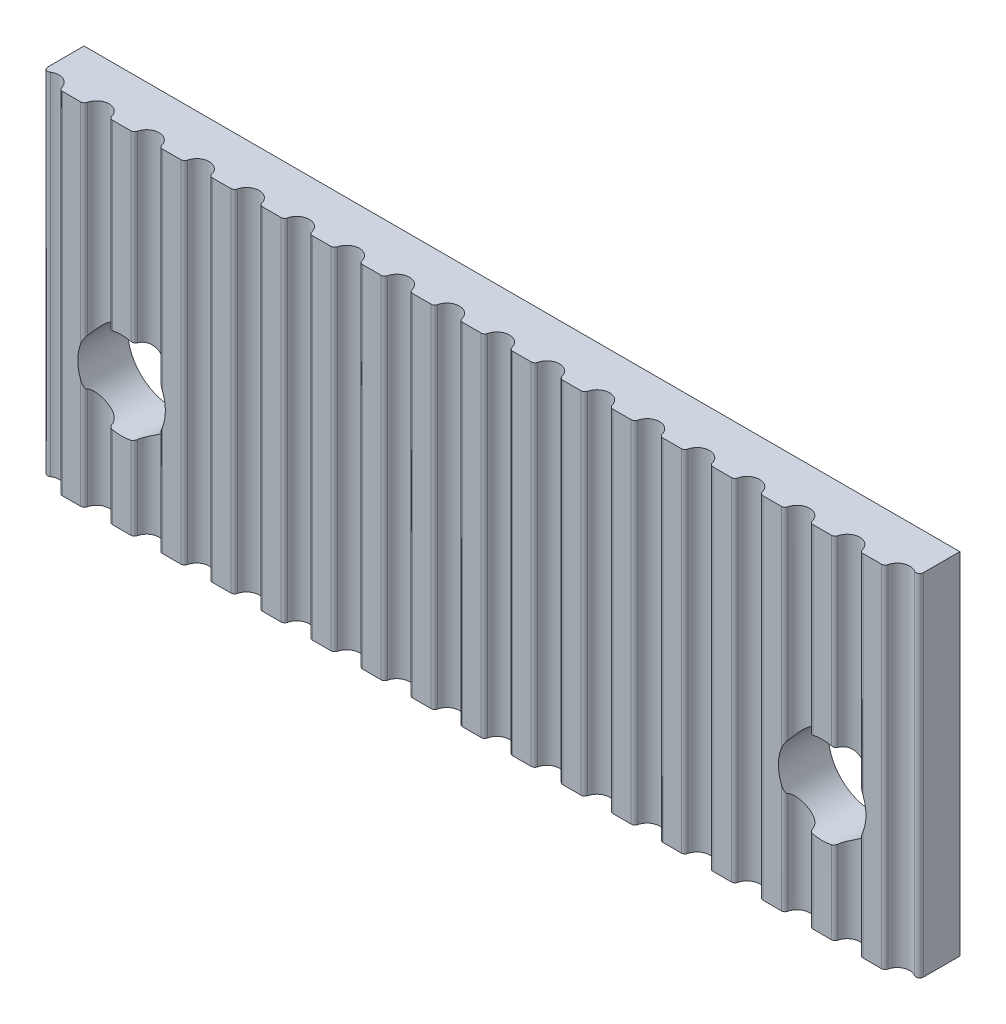
from build123d import *

# Parameters (mm, degrees)
SKETCH1_W           = 35
SKETCH1_H           = 2
BOSS_EXTRUDE1_DEPTH = 14
SKETCH2_R           = 1.75
CUT_EXTRUDE1_DEPTH  = 14
SKETCH3_R           = 0.5
CUT_EXTRUDE2_DEPTH  = 23.433234274
LPATTERN1_COUNT     = 18
LPATTERN1_PITCH     = 2
FILLET1_R           = 0.15


with BuildPart() as part:
    # Sketch1 → Boss-Extrude1 (new body)
    with BuildSketch(Plane(origin=(0, 0, 0), x_dir=(1, 0, 0), z_dir=(0, 1, 0))):
        Rectangle(SKETCH1_W, SKETCH1_H)
    extrude(amount=BOSS_EXTRUDE1_DEPTH)

    # Sketch2 → Cut-Extrude1 (cut)
    with BuildSketch(Plane.XY.offset(1)):
        with Locations((-14, 5)):
            Circle(SKETCH2_R)
        with Locations((14, 5)):
            Circle(SKETCH2_R)
    extrude(amount=-CUT_EXTRUDE1_DEPTH, mode=Mode.SUBTRACT)

    # Sketch3 → Cut-Extrude2 (cut, through all)
    with BuildSketch(Plane(origin=(0, 14, 0), x_dir=(1, 0, 0), z_dir=(0, 1, 0))):
        with Locations((-17, -1)):
            Circle(SKETCH3_R)
    cut_extrude2 = extrude(amount=-CUT_EXTRUDE2_DEPTH, mode=Mode.SUBTRACT)

    # LPattern1: Cut-Extrude2 ×18
    with Locations(*[(i * LPATTERN1_PITCH, 0, 0) for i in range(1, LPATTERN1_COUNT)]):
        add(cut_extrude2, mode=Mode.SUBTRACT)

    # Fillet1
    fillet1_edges = [part.edges().sort_by_distance(p)[0] for p in [
        (-16.5, 7, 1),
        (-17.5, 7, 1),
        (-15.5, 9.950693909, 1),
        (12.5, 2.049306091, 1),
        (13.5, 1.661474508, 1),
        (14.5, 1.661474508, 1),
        (15.5, 2.049306091, 1),
        (17.5, 7, 1),
        (16.5, 7, 1),
        (15.5, 9.950693909, 1),
        (14.5, 10.338525492, 1),
        (13.5, 10.338525492, 1),
        (12.5, 9.950693909, 1),
        (11.5, 7, 1),
        (10.5, 7, 1),
        (9.5, 7, 1),
        (8.5, 7, 1),
        (7.5, 7, 1),
        (6.5, 7, 1),
        (5.5, 7, 1),
        (4.5, 7, 1),
        (3.5, 7, 1),
        (2.5, 7, 1),
        (1.5, 7, 1),
        (0.5, 7, 1),
        (-0.5, 7, 1),
        (-1.5, 7, 1),
        (-2.5, 7, 1),
        (-3.5, 7, 1),
        (-4.5, 7, 1),
        (-5.5, 7, 1),
        (-6.5, 7, 1),
        (-7.5, 7, 1),
        (-8.5, 7, 1),
        (-12.5, 9.950693909, 1),
        (-13.5, 10.338525492, 1),
        (-14.5, 10.338525492, 1),
        (-9.5, 7, 1),
        (-10.5, 7, 1),
        (-11.5, 7, 1),
        (-12.5, 2.049306091, 1),
        (-13.5, 1.661474508, 1),
        (-14.5, 1.661474508, 1),
        (-15.5, 2.049306091, 1),
    ]]
    fillet(fillet1_edges, radius=FILLET1_R)


solid = part.part
